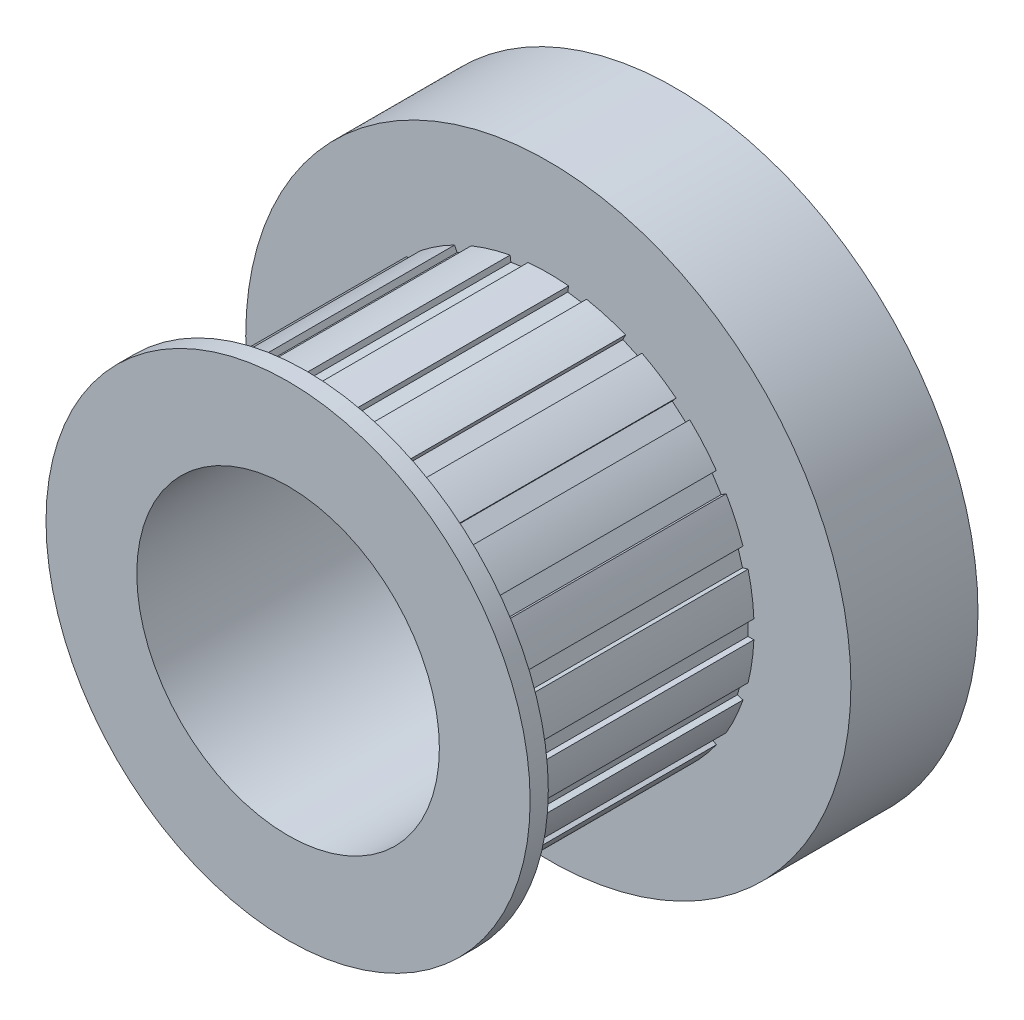
from build123d import *

# Parameters (mm, degrees)
SKETCH1_R           = 10.16
BOSS_EXTRUDE1_DEPTH = 0.762
SKETCH2_R           = 8.636
BOSS_EXTRUDE2_DEPTH = 10.16
SKETCH3_R           = 12.7
BOSS_EXTRUDE3_DEPTH = 5.334
SKETCH4_R           = 6.35
CUT_EXTRUDE1_DEPTH  = 25.654
SKETCH5_W           = 10.16
SKETCH5_H           = 0.762
CUT_EXTRUDE2_DEPTH  = 0.254
CIRPATTERN1_COUNT   = 22


with BuildPart() as part:
    # Sketch1 → Boss-Extrude1 (new body)
    with BuildSketch(Plane.XY):
        Circle(SKETCH1_R)
    extrude(amount=-BOSS_EXTRUDE1_DEPTH)

    # Sketch2 → Boss-Extrude2 (add)
    with BuildSketch(Plane(origin=(0, 0, -0.762), x_dir=(-1, 0, 0), z_dir=(0, 0, -1))):
        Circle(SKETCH2_R)
    extrude(amount=BOSS_EXTRUDE2_DEPTH)

    # Sketch3 → Boss-Extrude3 (add)
    with BuildSketch(Plane(origin=(0, 0, -10.922), x_dir=(-1, 0, 0), z_dir=(0, 0, -1))):
        Circle(SKETCH3_R)
    extrude(amount=BOSS_EXTRUDE3_DEPTH)

    # Sketch4 → Cut-Extrude1 (cut)
    with BuildSketch(Plane.XY):
        Circle(SKETCH4_R)
    extrude(amount=-CUT_EXTRUDE1_DEPTH, mode=Mode.SUBTRACT)

    # Sketch5 → Cut-Extrude2 (cut)
    with BuildSketch(Plane.ZY.offset(8.636)):
        with Locations((-5.842, 0)):
            Rectangle(SKETCH5_W, SKETCH5_H)
    cut_extrude2 = extrude(amount=-CUT_EXTRUDE2_DEPTH, mode=Mode.SUBTRACT)

    # CirPattern1: Cut-Extrude2 ×22 about axis
    cirpattern1_axis = Axis((0, 0, -16.256), (0, 0, 1))
    for i in range(1, CIRPATTERN1_COUNT):
        add(cut_extrude2.rotate(cirpattern1_axis, i * 360 / CIRPATTERN1_COUNT), mode=Mode.SUBTRACT)


solid = part.part
